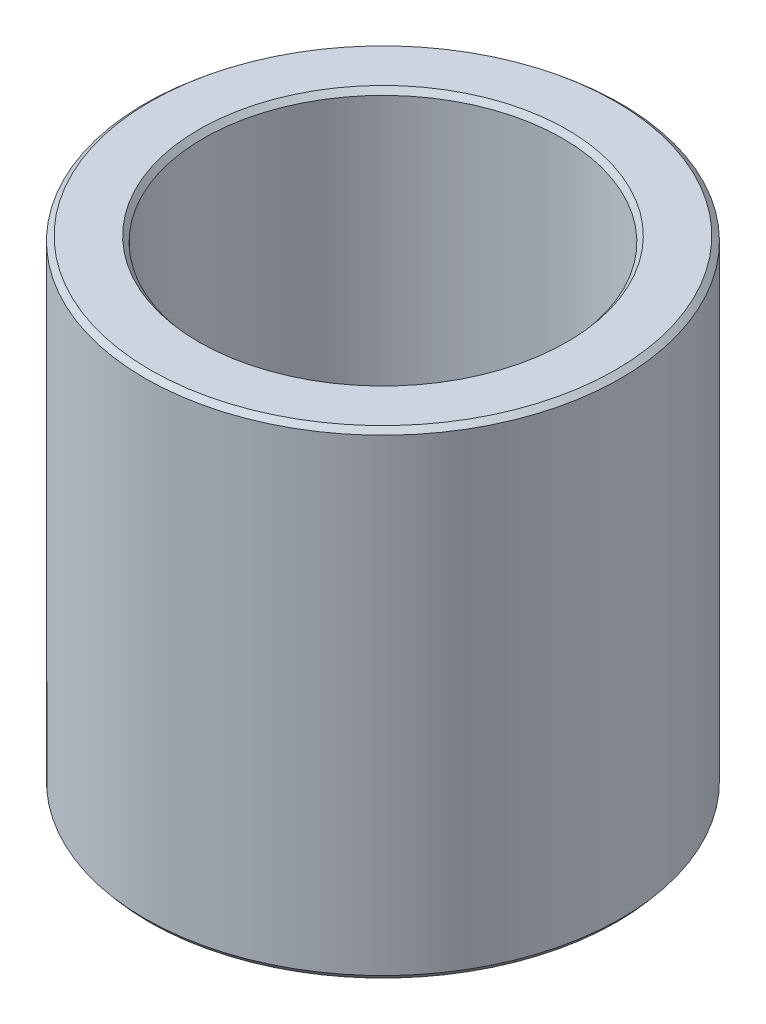
from build123d import *
from OCP.BRepFilletAPI import BRepFilletAPI_MakeChamfer

# Parameters (mm, degrees)
SKETCH1_R           = 27.5
BOSS_EXTRUDE1_DEPTH = 55.229403765
SKETCH2_R           = 20.754223892
CUT_EXTRUDE1_DEPTH  = 68.548405164
CHAMFER1_SIZE       = 0.523153669
CHAMFER1_SIZE2      = 0.623855248


with BuildPart() as part:
    # Sketch1 → Boss-Extrude1 (new body)
    with BuildSketch(Plane(origin=(0, 0, 0), x_dir=(1, 0, 0), z_dir=(0, 1, 0))):
        Circle(SKETCH1_R)
    extrude(amount=BOSS_EXTRUDE1_DEPTH)

    # Sketch2 → Cut-Extrude1 (cut, through all)
    with BuildSketch(Plane(origin=(0, 0, 0), x_dir=(1, 0, 0), z_dir=(0, 1, 0))):
        Circle(SKETCH2_R)
    extrude(amount=CUT_EXTRUDE1_DEPTH, mode=Mode.SUBTRACT)

    # Chamfer1: one chamfer whose edges measure the first distance from different faces: ONE call of the kernel's chamfer builder (chamfer() names one face for all edges)
    chamfer1_edges_1 = [part.edges().sort_by_distance(p)[0] for p in [
        (-20.754223892, 55.229403765, 0),
    ]]
    chamfer1_side_1 = [part.faces().sort_by_distance(p)[0] for p in [
        (-26.722182541, 55.229403765, 0),
    ]]
    chamfer1_edges_2 = [part.edges().sort_by_distance(p)[0] for p in [
        (-20.754223892, 0, 0),
    ]]
    chamfer1_side_2 = [part.faces().sort_by_distance(p)[0] for p in [
        (-20.754223892, 27.614701883, 0),
    ]]
    chamfer1_edges_3 = [part.edges().sort_by_distance(p)[0] for p in [
        (-27.5, 0, 0),
    ]]
    chamfer1_side_3 = [part.faces().sort_by_distance(p)[0] for p in [
        (-26.722182541, 0, 0),
    ]]
    chamfer1_edges_4 = [part.edges().sort_by_distance(p)[0] for p in [
        (-27.5, 55.229403765, 0),
    ]]
    chamfer1_side_4 = [part.faces().sort_by_distance(p)[0] for p in [
        (-27.5, 27.614701883, 0),
    ]]
    chamfer1 = BRepFilletAPI_MakeChamfer(part.part.solid().wrapped)
    for e in chamfer1_edges_1:
        chamfer1.Add(CHAMFER1_SIZE, CHAMFER1_SIZE2, e.wrapped, chamfer1_side_1[0].wrapped)  # the first distance lies on this face
    for e in chamfer1_edges_2:
        chamfer1.Add(CHAMFER1_SIZE, CHAMFER1_SIZE2, e.wrapped, chamfer1_side_2[0].wrapped)  # the first distance lies on this face
    for e in chamfer1_edges_3:
        chamfer1.Add(CHAMFER1_SIZE, CHAMFER1_SIZE2, e.wrapped, chamfer1_side_3[0].wrapped)  # the first distance lies on this face
    for e in chamfer1_edges_4:
        chamfer1.Add(CHAMFER1_SIZE, CHAMFER1_SIZE2, e.wrapped, chamfer1_side_4[0].wrapped)  # the first distance lies on this face
    add(Compound.cast(chamfer1.Shape()), mode=Mode.REPLACE)


solid = part.part
